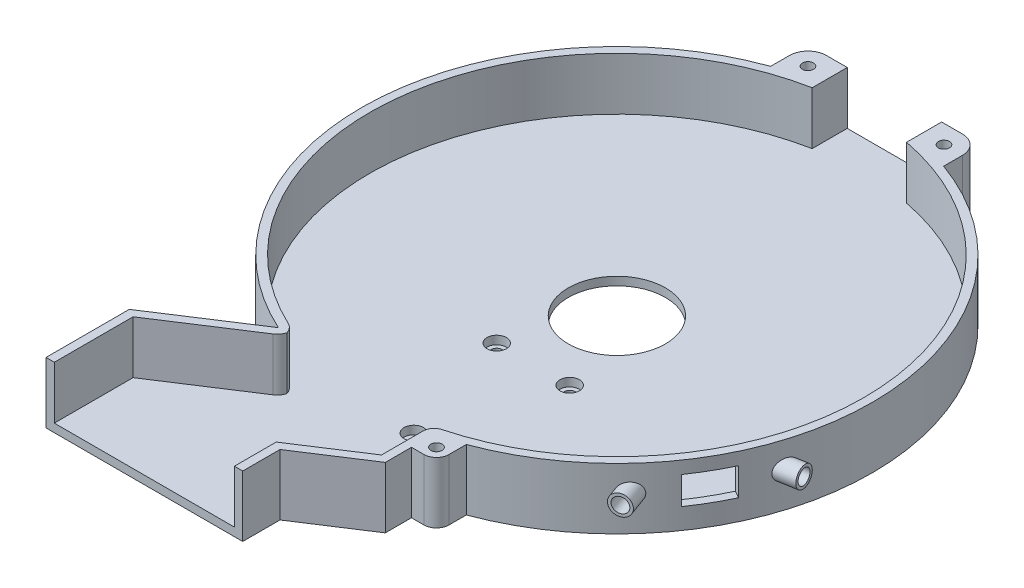
from build123d import *
from build123d.topology import SkipClean

# Parameters (mm, degrees)
SALIENTE_EXTRUIR1_DEPTH                   = 9.5
SALIENTE_EXTRUIR1_2_DEPTH                 = 9.5
CROQUIS4_R                                = 92
CROQUIS4_R_2                              = 17.5
SALIENTE_EXTRUIR3_DEPTH                   = 3
CROQUIS5_W                                = 42.3
CROQUIS5_H                                = 42.3
CROQUIS5_R                                = 19
CROQUIS5_R_2                              = 1.5
SALIENTE_EXTRUIR4_DEPTH                   = 10
CHAFL_N1_SIZE                             = 4
CROQUIS7_W                                = 46.3
CROQUIS7_H                                = 3
SALIENTE_EXTRUIR5_DEPTH                   = 70
SALIENTE_EXTRUIR7_START                   = -3.5
SALIENTE_EXTRUIR7_DEPTH                   = 7
CROQUIS15_W                               = 46.3
CROQUIS15_H                               = 2
SALIENTE_EXTRUIR8_DEPTH                   = 42.3
SALIENTE_EXTRUIR9_START                   = 21.15
SALIENTE_EXTRUIR9_DEPTH                   = 2
SALIENTE_EXTRUIR10_START                  = -100
SALIENTE_EXTRUIR10_DEPTH                  = 10.200223
CROQUIS20_R                               = 2
SALIENTE_EXTRUIR11_DEPTH                  = 22
CORTAR_EXTRUIR2_DEPTH                     = 3.3
SALIENTE_EXTRUIR30_DEPTH                  = 3
SALIENTE_EXTRUIR27_REACH                  = 242.733
SALIENTE_EXTRUIR27_END_RADIUS             = 92
CROQUIS60_W                               = 3
CROQUIS60_H                               = 22
SALIENTE_EXTRUIR27_DIRECTION_2_REACH      = 242.733
SALIENTE_EXTRUIR28_START                  = 89.078617
CROQUIS61_W                               = 3
CROQUIS61_H                               = 22
SALIENTE_EXTRUIR28_DEPTH                  = 15.72116
SALIENTE_EXTRUIR32_DEPTH                  = 3
SALIENTE_EXTRUIR33_DEPTH                  = 3
SALIENTE_EXTRUIR34_DEPTH                  = 19
REDONDEO9_R                               = 5
REDONDEO10_R                              = 4
CORTAR_EXTRUIR6_OUTLINE_W                 = 2.65
CORTAR_EXTRUIR6_OUTLINE_H                 = 6.147817537
CROQUIS32_R                               = 3.65
CROQUIS32_R_2                             = 2.65
SALIENTE_EXTRUIR16_DEPTH                  = 5.5
SALIENTE_EXTRUIR16_DIRECTION_2_REACH      = 234.007
SALIENTE_EXTRUIR16_DIRECTION_2_END_RADIUS = 92
CORTAR_EXTRUIR21_OUTLINE_W                = 2.65
CORTAR_EXTRUIR21_OUTLINE_H                = 6.147460621
SALIENTE_EXTRUIR36_REACH                  = 241.136
SALIENTE_EXTRUIR36_END_RADIUS             = 92
CROQUIS70_R                               = 3.65
CROQUIS70_R_2                             = 2.65
SALIENTE_EXTRUIR36_DIRECTION_2_DEPTH      = 5.5
CROQUIS35_R                               = 3.5
CORTAR_EXTRUIR8_DEPTH                     = 3
CROQUIS37_R                               = 6
CROQUIS37_R_2                             = 2
SALIENTE_EXTRUIR18_DEPTH                  = 3
CORTAR_EXTRUIR10_DEPTH                    = 3
CORTAR_EXTRUIR10_DEPTH_BACK               = 3
CROQUIS41_R                               = 3.5
CROQUIS44_R                               = 5
CORTAR_EXTRUIR12_DEPTH                    = 3
CROQUIS42_R                               = 6
CROQUIS42_R_2                             = 2
SALIENTE_EXTRUIR20_DEPTH                  = 3.3
CORTAR_EXTRUIR14_REACH                    = 186.655
SALIENTE_EXTRUIR22_DEPTH                  = 3.3
SALIENTE_EXTRUIR23_DEPTH                  = 5
CORTAR_EXTRUIR15_DEPTH                    = 3.3
SIMETR_A11_START                          = -15.8
SIMETR_A11_DEPTH                          = 3.3
SIMETR_A11_START_2                        = -20.8
SIMETR_A11_2_DEPTH                        = 5
SIMETR_A11_START_3                        = -17.5
SIMETR_A11_3_DEPTH                        = 1.7
SALIENTE_EXTRUIR24_DEPTH                  = 3.3
CROQUIS53_R                               = 8
SALIENTE_EXTRUIR25_DEPTH                  = 5
CORTAR_EXTRUIR16_DEPTH                    = 3.3
CROQUIS55_R                               = 2
CORTAR_EXTRUIR18_DEPTH                    = 179.638764318
CORTAR_EXTRUIR19_REACH                    = 227.915
CORTAR_EXTRUIR19_END_RADIUS               = 89
CROQUIS56_W                               = 15
CROQUIS56_H                               = 10
CROQUIS69_R                               = 2
SALIENTE_EXTRUIR35_DEPTH                  = 22


# Read off the part's stored shape, not the designer's step: Saliente-Extruir7, Saliente-Extruir9, Cortar-Extruir6, Cortar-Extruir21, Simetría11
with BuildPart() as part:
    # Croquis1 → Saliente-Extruir1 (new, symmetric)
    with BuildSketch(Plane(origin=(0, 0, 0), x_dir=(1, 0, 0), z_dir=(0, 1, 0))):
        with BuildLine():
            Line((-17, 87.361318671), (-17, 90.4157066))
            ThreePointArc((-17, 90.4157066), (-91.519881602, 9.386760442), (-35, -85.082313086))
            Line((-35, -85.082313086), (-35, -81.829090182))
            ThreePointArc((-35, -81.829090182), (-88.500557128, 9.415486605), (-17, 87.361318671))
        make_face()
    extrude(amount=SALIENTE_EXTRUIR1_DEPTH, both=True)



with BuildPart() as body_2:
    # Croquis1 → Saliente-Extruir1 2 (new, symmetric)
    with BuildSketch(Plane(origin=(0, 0, 0), x_dir=(1, 0, 0), z_dir=(0, 1, 0))):
        with BuildLine():
            ThreePointArc((20, -89.799777283), (91.987255409, 1.531287769), (17, 90.4157066))
            Line((17, 90.4157066), (17, 87.361318671))
            ThreePointArc((17, 87.361318671), (88.986787561, 1.533505674), (20, -86.723699183))
            Line((20, -86.723699183), (20, -89.799777283))
        make_face()
    extrude(amount=SALIENTE_EXTRUIR1_2_DEPTH, both=True)


with BuildPart() as body_3:
    # Croquis4 → Saliente-Extruir3 (new body)
    with BuildSketch(Plane.XZ.offset(9.5)):
        with Locations(Location((0, 0, 0), (0, 0, 270))):
            Circle(CROQUIS4_R)
        with Locations(Location((0, 0, 0), (0, 0, 270))):
            Circle(CROQUIS4_R_2, mode=Mode.SUBTRACT)
    extrude(amount=SALIENTE_EXTRUIR3_DEPTH)


with BuildPart() as body_4:
    # Croquis5 → Saliente-Extruir4 (new body)
    with BuildSketch(Plane(origin=(0, -12.5, 0), x_dir=(-1, 0, 0), z_dir=(0, -1, 0))):
        Rectangle(CROQUIS5_W, CROQUIS5_H)
        with Locations(Location((0, 0, 0), (0, 0, 90))):
            Circle(CROQUIS5_R, mode=Mode.SUBTRACT)
        with Locations(Location((-15.5, -15.5, 0), (0, 0, 90))):
            Circle(CROQUIS5_R_2, mode=Mode.SUBTRACT)
        with Locations(Location((15.5, -15.5, 0), (0, 0, 270))):
            Circle(CROQUIS5_R_2, mode=Mode.SUBTRACT)
        with Locations(Location((-15.5, 15.5, 0), (0, 0, 270))):
            Circle(CROQUIS5_R_2, mode=Mode.SUBTRACT)
        with Locations(Location((15.5, 15.5, 0), (0, 0, 90))):
            Circle(CROQUIS5_R_2, mode=Mode.SUBTRACT)
    extrude(amount=SALIENTE_EXTRUIR4_DEPTH)

    # Chaflán1
    chafl_n1_edges = [body_4.edges().sort_by_distance(p)[0] for p in [
        (-21.15, -17.5, 21.15),
        (21.15, -17.5, 21.15),
        (21.15, -17.5, -21.15),
        (-21.15, -17.5, -21.15),
    ]]
    chamfer(chafl_n1_edges, length=CHAFL_N1_SIZE)


with BuildPart() as body_4_2:
    # Croquis7 → Saliente-Extruir5 (new body)
    with BuildSketch(Plane.XZ.offset(12.5)):
        with Locations((0, 22.65)):
            Rectangle(CROQUIS7_W, CROQUIS7_H)
    extrude(amount=SALIENTE_EXTRUIR5_DEPTH)


with BuildPart() as body_5:
    # Saliente-Extruir7 outline → Saliente-Extruir7 (new body)
    with BuildSketch(Plane.YZ.offset(SALIENTE_EXTRUIR7_START)):
        Polygon((-12.5, 73.164527675), (-82.5, 24.15), (-12.5, 24.15), align=None)
    extrude(amount=SALIENTE_EXTRUIR7_DEPTH)

    # Croquis44 → Cortar-Extruir12 (cut)
    with BuildSketch(Plane.XZ.offset(12.5)):
        with Locations((0, 73.164527675)):
            Circle(CROQUIS44_R)
    extrude(amount=CORTAR_EXTRUIR12_DEPTH, mode=Mode.SUBTRACT)

    # Croquis42 → Saliente-Extruir20 (add)
    with BuildSketch(Plane.XZ.offset(12.5)):
        with Locations((0, 73.164527675)):
            Circle(CROQUIS42_R)
        with Locations((0, 73.164527675)):
            Circle(CROQUIS42_R_2, mode=Mode.SUBTRACT)
    extrude(amount=SALIENTE_EXTRUIR20_DEPTH)

    # Cortar-Extruir14: up to this face of the body (flat: up to its plane)
    cortar_extruir14_end = Plane(body_5.part.faces().sort_by_distance((-3.5, -35.990764188, 40.274069561))[0])
    # Croquis45 → Cortar-Extruir14 (cut, up to the picked face)
    with BuildSketch(Plane(origin=(3.5, 0, 0), x_dir=(0, 0, -1), z_dir=(1, 0, 0)), mode=Mode.PRIVATE) as cortar_extruir14_sk1:
        Polygon((-70.853842799, -15.95), (-68.141130502, -15.95), (-68.141130502, -12.5), (-68.291130502, -12.5), (-68.291130502, -15.8), (-70.853842799, -15.8), align=None)
    cortar_extruir14_tool1 = split(extrude(cortar_extruir14_sk1.sketch, amount=-CORTAR_EXTRUIR14_REACH, mode=Mode.PRIVATE), bisect_by=cortar_extruir14_end, keep=Keep.BOTH, mode=Mode.PRIVATE)
    add(cortar_extruir14_tool1.solids().sort_by(Axis((3.5, -15.906112, 69.497487), (-1, 0, 0)))[0], mode=Mode.SUBTRACT)


with BuildPart() as body_6:
    # Croquis15 → Saliente-Extruir8 (new body)
    with BuildSketch(Plane(origin=(0, 0, 21.15), x_dir=(-1, 0, 0), z_dir=(0, 0, -1))):
        with Locations((0, -81.5)):
            Rectangle(CROQUIS15_W, CROQUIS15_H)
    extrude(amount=SALIENTE_EXTRUIR8_DEPTH)


with BuildPart() as body_7:
    # Saliente-Extruir9 outline → Saliente-Extruir9 (new body)
    with BuildSketch(Plane.YZ.offset(SALIENTE_EXTRUIR9_START)):
        Polygon((-50.5, 21.15), (-80.5, 21.15), (-80.5, -8.85), align=None)
    extrude(amount=SALIENTE_EXTRUIR9_DEPTH)


with BuildPart() as body_8:
    # Simetría10: mirrored copy
    add(body_7.part.mirror(Plane(origin=(0, 0, 0), x_dir=(0, 0, 1), z_dir=(1, 0, 0))))


with BuildPart() as part_1:
    add(part.part)

    add(body_2.part)  # Saliente-Extruir10 merges body 2

    add(body_3.part)  # Saliente-Extruir10 merges body 3
    # Croquis19 → Saliente-Extruir10 (add)
    with BuildSketch(Plane.XY.offset(SALIENTE_EXTRUIR10_START)):
        Polygon((-17, 9.5), (-17, -9.5), (17, -9.5), (17, 9.5), (20, 9.5), (20, -12.5), (-20, -12.5), (-20, 9.5), align=None)
    extrude(amount=SALIENTE_EXTRUIR10_DEPTH)

    # Croquis20 → Saliente-Extruir11 (add)
    with BuildSketch(Plane(origin=(0, 9.5, 0), x_dir=(1, 0, 0), z_dir=(0, 1, 0))):
        with BuildLine():
            Line((-20, 100), (-24.5, 100))
            ThreePointArc((-24.5, 100), (-29.210678119, 98.048773235), (-31.161904883, 93.338095117))
            Line((-31.161904883, 93.338095117), (-31.161904883, 86.561744923))
            ThreePointArc((-31.161904883, 86.561744923), (-25.632134933, 88.357193588), (-20, 89.799777283))
            Line((-20, 89.799777283), (-20, 100))
        make_face()
        with Locations(Location((-24.5, 93.338095117, 0), (0, 0, 270))):
            Circle(CROQUIS20_R, mode=Mode.SUBTRACT)
    saliente_extruir11 = extrude(amount=-SALIENTE_EXTRUIR11_DEPTH)

    # Simetría2: Saliente-Extruir11 across plane
    add(saliente_extruir11.mirror(Plane(origin=(0, 0, 0), x_dir=(0, 0, 1), z_dir=(1, 0, 0))))

    # Croquis22 → Cortar-Extruir2 (cut)
    with BuildSketch(Plane.XZ.offset(12.5)):
        Polygon((22.479274058, -89.838095117), (26.520725942, -89.838095117), (28.541451884, -93.338095117), (26.520725942, -96.838095117), (22.479274058, -96.838095117), (20.458548116, -93.338095117), align=None)
        Polygon((-26.520725942, -89.838095117), (-28.541451884, -93.338095117), (-26.520725942, -96.838095117), (-22.479274058, -96.838095117), (-20.458548116, -93.338095117), (-22.479274058, -89.838095117), align=None)
    extrude(amount=-CORTAR_EXTRUIR2_DEPTH, mode=Mode.SUBTRACT)

    # Croquis65 → Saliente-Extruir30 (add)
    with BuildSketch(Plane(origin=(0, -9.5, 0), x_dir=(1, 0, 0), z_dir=(0, 1, 0))):
        with BuildLine():
            Line((-35, -85.082313086), (-65.36325562, -104.799777283))
            Line((-65.36325562, -104.799777283), (20, -104.799777283))
            Line((20, -104.799777283), (20, -89.799777283))
            ThreePointArc((20, -89.799777283), (-7.862163641, -91.66344082), (-35, -85.082313086))
        make_face()
    extrude(amount=-SALIENTE_EXTRUIR30_DEPTH)

    # Saliente-Extruir27: up to this cylinder (the profile starts outside it)
    saliente_extruir27_end = Plane(origin=(0, -1.5, 0), z_dir=(0, -1, 0)) * Cylinder(SALIENTE_EXTRUIR27_END_RADIUS, 670.466, mode=Mode.PRIVATE)
    # Croquis60 → Saliente-Extruir27 (add, up to the surface)
    with BuildSketch(Plane(origin=(-77.158463621, 0, 50.105603396), x_dir=(-0.544626123873699, 0, -0.8386789523973464), z_dir=(0.8386789523973464, 0, -0.544626123873699)), mode=Mode.PRIVATE) as saliente_extruir27_sk1:
        with Locations((-50.794830871, -1.5)):
            Rectangle(CROQUIS60_W, CROQUIS60_H)
    saliente_extruir27_tool1 = extrude(saliente_extruir27_sk1.sketch, amount=SALIENTE_EXTRUIR27_REACH, mode=Mode.PRIVATE) - saliente_extruir27_end
    add(saliente_extruir27_tool1.solids().sort_by_distance((-49.494272, -1.5, 92.706159))[0])

    # Saliente-Extruir27 direction 2: up to this plane
    saliente_extruir27_direction_2_end = Plane(origin=(-65.36325562, -100.11086579, 104.799777283), z_dir=(0, 0, 1))
    # Croquis60 → Saliente-Extruir27 direction 2 (add, up to the surface)
    with BuildSketch(Plane(origin=(-77.158463621, 0, 50.105603396), x_dir=(-0.544626123873699, 0, -0.8386789523973464), z_dir=(0.8386789523973464, 0, -0.544626123873699)), mode=Mode.PRIVATE) as saliente_extruir27_direction_2_sk1:
        with Locations((-50.794830871, -1.5)):
            Rectangle(CROQUIS60_W, CROQUIS60_H)
    saliente_extruir27_direction_2_tool1 = split(extrude(saliente_extruir27_direction_2_sk1.sketch, amount=-SALIENTE_EXTRUIR27_DIRECTION_2_REACH, mode=Mode.PRIVATE), bisect_by=saliente_extruir27_direction_2_end, keep=Keep.BOTH, mode=Mode.PRIVATE)
    add(saliente_extruir27_direction_2_tool1.solids().sort_by_distance((-49.494272, -1.5, 92.706159))[0])

    # Croquis61 → Saliente-Extruir28 (add)
    with BuildSketch(Plane.XY.offset(SALIENTE_EXTRUIR28_START)):
        with Locations((21.5, -1.5)):
            Rectangle(CROQUIS61_W, CROQUIS61_H)
    extrude(amount=SALIENTE_EXTRUIR28_DEPTH)

    # Croquis66 → Saliente-Extruir32 (add)
    with BuildSketch(Plane(origin=(0, -9.5, 0), x_dir=(1, 0, 0), z_dir=(0, 1, 0))):
        Polygon((-67.871621577, -104.799777283), (-67.871621577, -119.799777283), (-3.097974457, -119.799777283), (20, -104.799777283), align=None)
    extrude(amount=-SALIENTE_EXTRUIR32_DEPTH)

    # Croquis67 → Saliente-Extruir33 (add)
    with BuildSketch(Plane(origin=(0, -9.5, 0), x_dir=(1, 0, 0), z_dir=(0, 1, 0))):
        Polygon((20, -104.799777283), (23, -104.799777283), (23, -106.428644381), (0, -121.365019025), (0, -134.799777283), (-70.871621577, -134.799777283), (-70.871621577, -104.799777283), (-67.871621577, -104.799777283), (-67.871621577, -119.799777283), (-3.097974457, -119.799777283), align=None)
    extrude(amount=-SALIENTE_EXTRUIR33_DEPTH)

    # Croquis68 → Saliente-Extruir34 (add)
    with BuildSketch(Plane(origin=(0, -9.5, 0), x_dir=(1, 0, 0), z_dir=(0, 1, 0))):
        Polygon((-67.871621577, -106.428674281), (-67.871621577, -134.799777283), (-70.871621577, -134.799777283), (-70.871621577, -104.799777283), (-65.36325562, -104.799777283), align=None)
        Polygon((20, -104.799777283), (-3, -119.736151926), (-3, -134.799777283), (0, -134.799777283), (0, -121.365019025), (23, -106.428644381), (23, -104.799777283), align=None)
    extrude(amount=SALIENTE_EXTRUIR34_DEPTH)

    # Redondeo9
    # the kernel refuses this fillet: 5 mm, written as the material it takes off along each edge
    with BuildSketch(Plane(origin=(-35, 16.287070828, 85.082313086), x_dir=(0, 0, -1), z_dir=(0, -1, 0))) as redondeo9_piece_1:
        with BuildLine():
            CenterArc((REDONDEO9_R * 0.542965666212, -REDONDEO9_R), REDONDEO9_R, 90, 57.000882051)
            Line((-REDONDEO9_R * 0.295713286185, -REDONDEO9_R * 0.455373876126), (0, 0))
            Line((0, 0), (REDONDEO9_R * 0.542965666212, 0))
        make_face()
    extrude(amount=25.787070828, mode=Mode.SUBTRACT)
    with BuildSketch(Plane(origin=(-35, -9.5, 81.829090182), x_dir=(0, 0, 1), z_dir=(0, 1, 0))) as redondeo9_piece_2:
        with BuildLine():
            CenterArc((3.235591091, -5), REDONDEO9_R, 90, 64.815663466)
            ThreePointArc((-1.289125998, -2.872340426), (-0.631860926, -1.44187099), (0, 0))
            Line((0, 0), (3.235591091, 0))
        make_face()
    extrude(amount=27.088977727, mode=Mode.SUBTRACT)

    # Redondeo10
    redondeo10_edges = [part_1.edges().sort_by_distance(p)[0] for p in [
        (20, 0, 86.723699183),
    ]]
    fillet(redondeo10_edges, radius=REDONDEO10_R)

    # Cortar-Extruir6 outline → Cortar-Extruir6 (revolve, cut)
    with BuildSketch(Plane(origin=(7.255228308, 0, 41.146444401), x_dir=(0, 1, 0), z_dir=(-0.17364817766693907, 0, -0.9848077530122066))):
        with Locations((1.325, 80.189494924)):
            Rectangle(CORTAR_EXTRUIR6_OUTLINE_W, CORTAR_EXTRUIR6_OUTLINE_H)
    revolve(axis=Axis((7.255228308, 0, 41.146444401), (0.9848077530122066, 0, -0.17364817766693907)), mode=Mode.SUBTRACT)

    # Croquis32 → Saliente-Extruir16 (add)
    with BuildSketch(Plane(origin=(87.975419613, -9.5, 26.913296786), x_dir=(-0.17364817766693919, 0, -0.9848077530122067), z_dir=(0.9848077530122067, 0, -0.17364817766693919))):
        with Locations((0, 9.5)):
            Circle(CROQUIS32_R)
        with Locations((0, 9.5)):
            Circle(CROQUIS32_R_2, mode=Mode.SUBTRACT)
    extrude(amount=SALIENTE_EXTRUIR16_DEPTH)

    # Saliente-Extruir16 direction 2: up to this cylinder (the profile starts outside it)
    saliente_extruir16_direction_2_end = Plane(origin=(0, 0, 0), z_dir=(0, -1, 0)) * Cylinder(SALIENTE_EXTRUIR16_DIRECTION_2_END_RADIUS, 653.014, mode=Mode.PRIVATE)
    # Croquis32 → Saliente-Extruir16 direction 2 (add, up to the surface)
    with BuildSketch(Plane(origin=(87.975419613, -9.5, 26.913296786), x_dir=(-0.17364817766693919, 0, -0.9848077530122067), z_dir=(0.9848077530122067, 0, -0.17364817766693919)), mode=Mode.PRIVATE) as saliente_extruir16_direction_2_sk1:
        with Locations((0, 9.5)):
            Circle(CROQUIS32_R)
        with Locations((0, 9.5)):
            Circle(CROQUIS32_R_2, mode=Mode.SUBTRACT)
    saliente_extruir16_direction_2_tool1 = extrude(saliente_extruir16_direction_2_sk1.sketch, amount=-SALIENTE_EXTRUIR16_DIRECTION_2_REACH, mode=Mode.PRIVATE) - saliente_extruir16_direction_2_end
    add(saliente_extruir16_direction_2_tool1.solids().sort_by_distance((88.591308, 0, 30.406176))[0])

    # Cortar-Extruir21 outline → Cortar-Extruir21 (revolve, cut)
    with BuildSketch(Plane(origin=(39.261480281, 0, -14.290010176), x_dir=(0.9396926207859094, 0, -0.3420201433256659), z_dir=(0, -1, 0))):
        with Locations((1.325, 80.189673382)):
            Rectangle(CORTAR_EXTRUIR21_OUTLINE_W, CORTAR_EXTRUIR21_OUTLINE_H)
    revolve(axis=Axis((39.261480281, 0, -14.290010176), (0.3420201433256659, 0, 0.9396926207859094)), mode=Mode.SUBTRACT)

    # Saliente-Extruir36: up to this cylinder (the profile starts outside it)
    saliente_extruir36_end = Plane(origin=(0, 0, 0), z_dir=(0, -1, 0)) * Cylinder(SALIENTE_EXTRUIR36_END_RADIUS, 667.272, mode=Mode.PRIVATE)
    # Croquis70 → Saliente-Extruir36 (add, up to the surface)
    with BuildSketch(Plane(origin=(67.295308523, -9.5, 62.7322999), x_dir=(0.9396926207859095, 0, -0.3420201433256657), z_dir=(0.3420201433256657, 0, 0.9396926207859095)), mode=Mode.PRIVATE) as saliente_extruir36_sk1:
        with Locations((0, 9.5)):
            Circle(CROQUIS70_R)
        with Locations((0, 9.5)):
            Circle(CROQUIS70_R_2, mode=Mode.SUBTRACT)
    saliente_extruir36_tool1 = extrude(saliente_extruir36_sk1.sketch, amount=-SALIENTE_EXTRUIR36_REACH, mode=Mode.PRIVATE) - saliente_extruir36_end
    add(saliente_extruir36_tool1.solids().sort_by_distance((63.962442, 0, 63.945364))[0])

    # Croquis70 → Saliente-Extruir36 direction 2 (add)
    with SkipClean():  # the faces are left unmerged after this step: merging them gives an invalid solid
        with BuildSketch(Plane(origin=(67.295308523, -9.5, 62.7322999), x_dir=(0.9396926207859095, 0, -0.3420201433256657), z_dir=(0.3420201433256657, 0, 0.9396926207859095))):
            with Locations((0, 9.5)):
                Circle(CROQUIS70_R)
            with Locations((0, 9.5)):
                Circle(CROQUIS70_R_2, mode=Mode.SUBTRACT)
        extrude(amount=SALIENTE_EXTRUIR36_DIRECTION_2_DEPTH)
    add(part_1.part.scale(1), mode=Mode.REPLACE)  # the faces are merged on a copy

    # Croquis35 → Cortar-Extruir8 (cut)
    with BuildSketch(Plane.XZ.offset(12.5)):
        with Locations((-13.15, 30.15)):
            Circle(CROQUIS35_R)
    cortar_extruir8 = extrude(amount=-CORTAR_EXTRUIR8_DEPTH, mode=Mode.SUBTRACT)

    # Simetría3: Cortar-Extruir8 across plane
    add(cortar_extruir8.mirror(Plane(origin=(0, 0, 0), x_dir=(0, 0, 1), z_dir=(1, 0, 0))), mode=Mode.SUBTRACT)

    # Croquis41 → Cortar-Extruir10 (cut, two sides: drawn at the far end of the back side and taken through both)
    with BuildSketch(Plane.XZ.offset(12.5).offset(-CORTAR_EXTRUIR10_DEPTH_BACK)):
        with Locations(Location((0, 73.164527675, 0), (0, 0, 180))):
            Circle(CROQUIS41_R)
    extrude(amount=CORTAR_EXTRUIR10_DEPTH + CORTAR_EXTRUIR10_DEPTH_BACK, mode=Mode.SUBTRACT)

    # Cortar-Extruir19: up to this cylinder (the profile starts outside it)
    cortar_extruir19_end = Plane(origin=(0, 0, 0), z_dir=(0, -1, 0)) * Cylinder(CORTAR_EXTRUIR19_END_RADIUS, 634.83, mode=Mode.PRIVATE)
    # Croquis56 → Cortar-Extruir19 (cut, up to the surface)
    with BuildSketch(Plane(origin=(79.674337148, 0, 46), x_dir=(-0.4999999999999977, 0, 0.8660254037844399), z_dir=(-0.8660254037844399, 0, -0.4999999999999977)), mode=Mode.PRIVATE) as cortar_extruir19_sk1:
        Rectangle(CROQUIS56_W, CROQUIS56_H)
    cortar_extruir19_tool1 = extrude(cortar_extruir19_sk1.sketch, amount=CORTAR_EXTRUIR19_REACH, mode=Mode.PRIVATE) - cortar_extruir19_end
    add(cortar_extruir19_tool1.solids().sort_by_distance((79.674337, 0, 46))[0], mode=Mode.SUBTRACT)

    # Croquis69 → Saliente-Extruir35 (add)
    with BuildSketch(Plane(origin=(0, 9.5, 0), x_dir=(1, 0, 0), z_dir=(0, 1, 0))):
        with BuildLine():
            Line((27.5, -96.998648639), (23, -96.998648639))
            Line((23, -96.998648639), (23, -89.078616963))
            Line((23, -89.078616963), (32, -86.255434611))
            Line((32, -86.255434611), (32, -92.498648639))
            ThreePointArc((32, -92.498648639), (30.681980515, -95.680629154), (27.5, -96.998648639))
        make_face()
        with Locations(Location((27.5, -92.498648639, 0), (0, 0, 270))):
            Circle(CROQUIS69_R, mode=Mode.SUBTRACT)
    extrude(amount=-SALIENTE_EXTRUIR35_DEPTH)


with BuildPart() as body_7_2:
    # Croquis37 → Saliente-Extruir18 (new body)
    with BuildSketch(Plane.XZ.offset(12.5)):
        with Locations((-13.15, 30.15)):
            Circle(CROQUIS37_R)
        with Locations((-13.15, 30.15)):
            Circle(CROQUIS37_R_2, mode=Mode.SUBTRACT)
    extrude(amount=SALIENTE_EXTRUIR18_DEPTH)


with BuildPart() as body_8_2:
    # Simetría5: mirrored copy
    add(body_7_2.part.mirror(Plane(origin=(0, 0, 0), x_dir=(0, 0, 1), z_dir=(1, 0, 0))))


with BuildPart() as cortar_extruir14_piece_1:
    # of the separate pieces the step leaves, piece 1, a body of its own (cortar_extruir14_pieces)
    add(body_5.part.solids().sort_by_distance((3.5, -12.5, 68.141130502))[0])


with BuildPart() as cortar_extruir14_piece_2:
    # of the separate pieces the step leaves, piece 2, a body of its own (cortar_extruir14_pieces)
    add(body_5.part.solids().sort_by_distance((-3.5, -12.5, 68.291130502))[0])


with BuildPart() as body_10:
    # Croquis46 → Saliente-Extruir22 (new body)
    with BuildSketch(Plane.XZ.offset(12.5)):
        with BuildLine():
            Line((6.95, 30.15), (6.95, 24.15))
            Line((6.95, 24.15), (5.15, 24.15))
            Line((5.15, 24.15), (5.15, 30.15))
            ThreePointArc((5.15, 30.15), (13.15, 38.15), (21.15, 30.15))
            Line((21.15, 30.15), (21.15, 24.15))
            Line((21.15, 24.15), (19.35, 24.15))
            Line((19.35, 24.15), (19.35, 30.15))
            ThreePointArc((19.35, 30.15), (13.15, 36.35), (6.95, 30.15))
        make_face()
    extrude(amount=SALIENTE_EXTRUIR22_DEPTH)


with BuildPart() as body_11:
    # Croquis48 → Saliente-Extruir23 (new body)
    with BuildSketch(Plane.XZ.offset(15.8)):
        with BuildLine():
            Line((5.15, 30.15), (5.15, 24.15))
            Line((5.15, 24.15), (21.15, 24.15))
            Line((21.15, 24.15), (21.15, 30.15))
            ThreePointArc((21.15, 30.15), (13.15, 38.15), (5.15, 30.15))
        make_face()
    extrude(amount=SALIENTE_EXTRUIR23_DEPTH)

    # Croquis50 → Cortar-Extruir15 (cut)
    with BuildSketch(Plane.XZ.offset(20.8)):
        Polygon((15.170725942, 26.65), (17.191451884, 30.15), (15.170725942, 33.65), (11.129274058, 33.65), (9.108548116, 30.15), (11.129274058, 26.65), align=None)
    extrude(amount=-CORTAR_EXTRUIR15_DEPTH, mode=Mode.SUBTRACT)


with BuildPart() as body_12:
    # Simetría11 outline → Simetría11 (new body)
    with BuildSketch(Plane(origin=(0, 0, 0), x_dir=(1, 0, 0), z_dir=(0, 1, 0)).offset(SIMETR_A11_START)):
        with BuildLine():
            ThreePointArc((-6.95, -30.15), (-13.15, -36.35), (-19.35, -30.15))
            Line((-19.35, -30.15), (-19.35, -24.15))
            Line((-19.35, -24.15), (-21.15, -24.15))
            Line((-21.15, -24.15), (-21.15, -30.15))
            ThreePointArc((-21.15, -30.15), (-13.15, -38.15), (-5.15, -30.15))
            Line((-5.15, -30.15), (-5.15, -24.15))
            Line((-5.15, -24.15), (-6.95, -24.15))
            Line((-6.95, -24.15), (-6.95, -30.15))
        make_face()
    extrude(amount=SIMETR_A11_DEPTH)


with BuildPart() as body_13:
    # Simetr_a11 2 outline → Simetr_a11 2 (new body)
    with BuildSketch(Plane(origin=(0, 0, 0), x_dir=(1, 0, 0), z_dir=(0, 1, 0)).offset(SIMETR_A11_START_2)):
        with BuildLine():
            Line((-21.15, -24.15), (-21.15, -30.15))
            ThreePointArc((-21.15, -30.15), (-13.15, -38.15), (-5.15, -30.15))
            Line((-5.15, -30.15), (-5.15, -24.15))
            Line((-5.15, -24.15), (-21.15, -24.15))
        make_face()
        Polygon((-15.170725942, -26.65), (-11.129274058, -26.65), (-9.108548116, -30.15), (-11.129274058, -33.65), (-15.170725942, -33.65), (-17.191451884, -30.15), align=None, mode=Mode.SUBTRACT)
    extrude(amount=SIMETR_A11_2_DEPTH)

    # Simetr_a11 3 outline → Simetr_a11 3 (add)
    with BuildSketch(Plane(origin=(0, 0, 0), x_dir=(1, 0, 0), z_dir=(0, 1, 0)).offset(SIMETR_A11_START_3)):
        Polygon((-9.108548116, -30.15), (-11.129274058, -26.65), (-15.170725942, -26.65), (-17.191451884, -30.15), (-15.170725942, -33.65), (-11.129274058, -33.65), align=None)
    extrude(amount=SIMETR_A11_3_DEPTH)


with BuildPart() as body_14:
    # Croquis51 → Saliente-Extruir24 (new body)
    with BuildSketch(Plane.XZ.offset(12.5)):
        with BuildLine():
            Line((3.5, 68.107601731), (3.5, 65.97078039))
            ThreePointArc((3.5, 65.97078039), (0, 81.164527675), (-3.5, 65.97078039))
            Line((-3.5, 65.97078039), (-3.5, 68.107601731))
            ThreePointArc((-3.5, 68.107601731), (0, 79.314527675), (3.5, 68.107601731))
        make_face()
    extrude(amount=SALIENTE_EXTRUIR24_DEPTH)


with BuildPart() as body_15:
    # Croquis53 → Saliente-Extruir25 (new body)
    with BuildSketch(Plane.XZ.offset(15.8)):
        with Locations((0, 73.164527675)):
            Circle(CROQUIS53_R)
    extrude(amount=SALIENTE_EXTRUIR25_DEPTH)

    # Croquis54 → Cortar-Extruir16 (cut)
    with BuildSketch(Plane.XZ.offset(20.8)):
        Polygon((2.020725942, 69.664527675), (4.041451884, 73.164527675), (2.020725942, 76.664527675), (-2.020725942, 76.664527675), (-4.041451884, 73.164527675), (-2.020725942, 69.664527675), align=None)
    extrude(amount=-CORTAR_EXTRUIR16_DEPTH, mode=Mode.SUBTRACT)


with BuildPart() as cortar_extruir18_tool:
    # Croquis55 → Cortar-Extruir18 (new, through all)
    with BuildSketch(Plane.XZ.offset(12.5)):
        with Locations(Location((13.15, 30.15, 0), (0, 0, 180))):
            Circle(CROQUIS55_R)
        with Locations((0, 73.164527675)):
            Circle(CROQUIS55_R)
        with Locations((-13.15, 30.15)):
            Circle(CROQUIS55_R)
    extrude(amount=CORTAR_EXTRUIR18_DEPTH)


with BuildPart() as body_11_1:
    add(body_11.part)

    # Cortar-Extruir18: cut by cortar_extruir18_tool
    add(cortar_extruir18_tool.part, mode=Mode.SUBTRACT)


with BuildPart() as body_13_1:
    add(body_13.part)

    # Cortar-Extruir18: cut by cortar_extruir18_tool
    add(cortar_extruir18_tool.part, mode=Mode.SUBTRACT)


with BuildPart() as body_15_1:
    add(body_15.part)

    # Cortar-Extruir18: cut by cortar_extruir18_tool
    add(cortar_extruir18_tool.part, mode=Mode.SUBTRACT)


solid = Compound([part_1.part, body_7_2.part, body_8_2.part, cortar_extruir14_piece_2.part])
